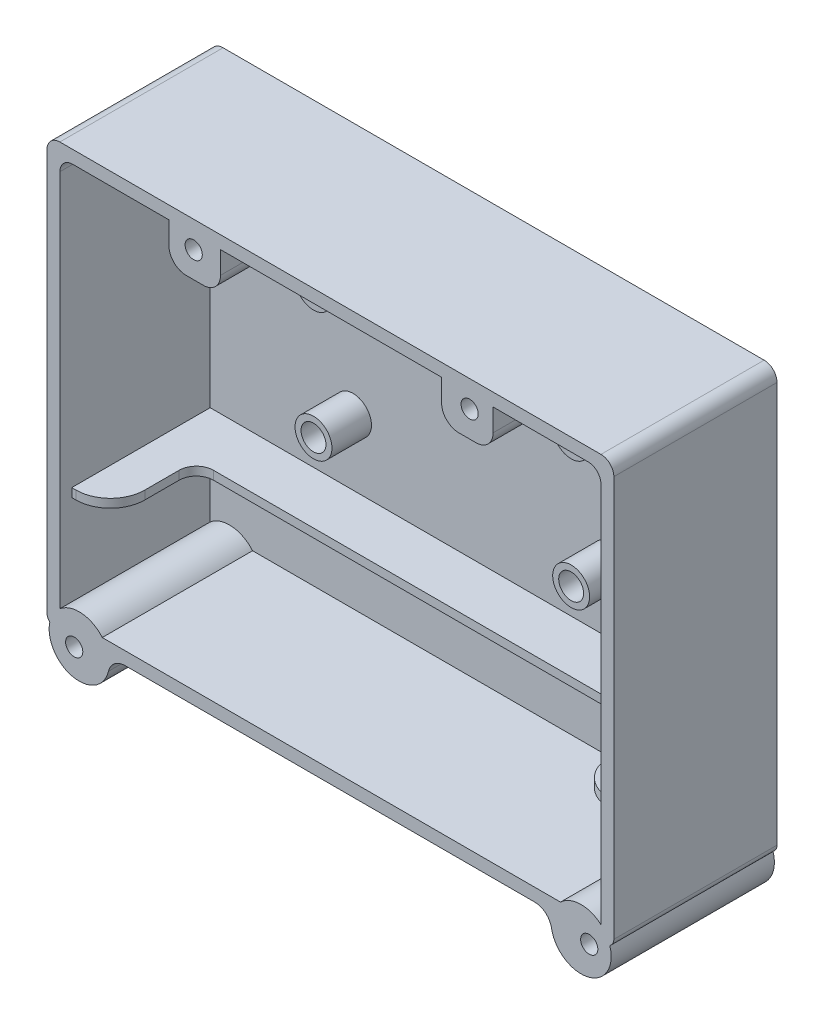
from build123d import *

# Parameters (mm, degrees)
SKETCH1_W           = 66
SKETCH1_H           = 49
BOSS_EXTRUDE1_DEPTH = 19
SHELL1_T            = -1.5
SKETCH2_W           = 6
SKETCH2_H           = 4.6
BOSS_EXTRUDE2_DEPTH = 17.5
FILLET1_R           = 1.5
SKETCH3_R           = 2.15
SKETCH3_R_2         = 1.45
BOSS_EXTRUDE3_DEPTH = 4.6
BOSS_EXTRUDE4_DEPTH = 0.5
FILLET2_R           = 4
FILLET3_R           = 2
BOSS_EXTRUDE5_REACH = 351.368
SKETCH5_R           = 3.5
FILLET4_R           = 2
SKETCH6_R           = 1
CUT_EXTRUDE1_DEPTH  = 350.367542449
FILLET5_R           = 1


with BuildPart() as part:
    # Sketch1 → Boss-Extrude1 (new body)
    with BuildSketch(Plane.XY.offset(30)):
        with Locations((105.809562907, 295.544660887)):
            Rectangle(SKETCH1_W, SKETCH1_H)
    extrude(amount=BOSS_EXTRUDE1_DEPTH)

    # Shell1
    shell1_openings = [part.faces().sort_by_distance(p)[0] for p in [
        (105.809562907, 295.544660887, 49),
    ]]
    offset(amount=SHELL1_T, openings=shell1_openings, kind=Kind.INTERSECTION)

    # Sketch2 → Boss-Extrude2 (add)
    with BuildSketch(Plane.XY.offset(31.5)):
        with Locations((90.011318394, 316.244660887)):
            Rectangle(SKETCH2_W, SKETCH2_H)
        with Locations((121.756668801, 316.244660887)):
            Rectangle(SKETCH2_W, SKETCH2_H)
    extrude(amount=BOSS_EXTRUDE2_DEPTH)

    # Fillet1
    fillet1_edges = [part.edges().sort_by_distance(p)[0] for p in [
        (74.309562907, 318.544660887, 40.25),
        (137.309562907, 318.544660887, 40.25),
        (72.809562907, 320.044660887, 39.5),
        (138.809562907, 320.044660887, 39.5),
    ]]
    fillet(fillet1_edges, radius=FILLET1_R)

    # Sketch3 → Boss-Extrude3 (add)
    # profile 1 of 4: a face of its own
    with BuildSketch(Plane.XY.offset(31.5)):
        with Locations((90.939840403, 307.111410879)):
            Circle(SKETCH3_R)
        with Locations((90.939840403, 307.111410879)):
            Circle(SKETCH3_R_2, mode=Mode.SUBTRACT)
    # profile 2 of 4: a face of its own
    with BuildSketch(Plane.XY.offset(31.5)):
        with Locations((120.939840403, 307.111410879)):
            Circle(SKETCH3_R)
        with Locations((120.939840403, 307.111410879)):
            Circle(SKETCH3_R_2, mode=Mode.SUBTRACT)
    # profile 3 of 4: a face of its own
    with BuildSketch(Plane.XY.offset(31.5)):
        with Locations((120.939840403, 292.111410879)):
            Circle(SKETCH3_R)
        with Locations((120.939840403, 292.111410879)):
            Circle(SKETCH3_R_2, mode=Mode.SUBTRACT)
    # profile 4 of 4: a face of its own
    with BuildSketch(Plane.XY.offset(31.5)):
        with Locations((90.939840403, 292.111410879)):
            Circle(SKETCH3_R)
        with Locations((90.939840403, 292.111410879)):
            Circle(SKETCH3_R_2, mode=Mode.SUBTRACT)
    extrude(amount=BOSS_EXTRUDE3_DEPTH)

    # Sketch4 → Boss-Extrude4 (add, symmetric)
    with BuildSketch(Plane(origin=(0, 284, 0), x_dir=(1, 0, 0), z_dir=(0, 1, 0))):
        Polygon((72.809562907, -47.615589413), (78.809562907, -47.615589413), (78.809562907, -37.615589413), (132.809562907, -37.615589413), (132.809562907, -47.615589413), (138.809562907, -47.615589413), (138.809562907, -30), (72.809562907, -30), align=None)
    extrude(amount=BOSS_EXTRUDE4_DEPTH, both=True)

    # Fillet2
    fillet2_edges = [part.edges().sort_by_distance(p)[0] for p in [
        (78.809562907, 284, 47.615589413),
        (132.809562907, 284, 47.615589413),
    ]]
    fillet(fillet2_edges, radius=FILLET2_R)

    # Fillet3
    fillet3_edges = [part.edges().sort_by_distance(p)[0] for p in [
        (78.809562907, 284, 37.615589413),
        (132.809562907, 284, 37.615589413),
    ]]
    fillet(fillet3_edges, radius=FILLET3_R)

    # Boss-Extrude5: up to this face of the body (flat: up to its plane)
    boss_extrude5_end = Plane(part.part.faces().sort_by_distance((105.809562907, 295.537442811, 30))[0])
    # Sketch5 → Boss-Extrude5 (add, up to the picked face)
    with BuildSketch(Plane.XY.offset(49), mode=Mode.PRIVATE) as boss_extrude5_sk1:
        with Locations((76.56102911, 270.299359986)):
            Circle(SKETCH5_R)
    boss_extrude5_tool1 = split(extrude(boss_extrude5_sk1.sketch, amount=-BOSS_EXTRUDE5_REACH, mode=Mode.PRIVATE), bisect_by=boss_extrude5_end, keep=Keep.BOTH, mode=Mode.PRIVATE)
    # Sketch5 → Boss-Extrude5 (add, up to the picked face)
    with BuildSketch(Plane.XY.offset(49), mode=Mode.PRIVATE) as boss_extrude5_sk2:
        with Locations((135, 270)):
            Circle(SKETCH5_R)
    boss_extrude5_tool2 = split(extrude(boss_extrude5_sk2.sketch, amount=-BOSS_EXTRUDE5_REACH, mode=Mode.PRIVATE), bisect_by=boss_extrude5_end, keep=Keep.BOTH, mode=Mode.PRIVATE)
    add(boss_extrude5_tool1.solids().sort_by(Axis((76.561029, 270.29936, 49), (0, 0, -1)))[0])
    add(boss_extrude5_tool2.solids().sort_by(Axis((135, 270, 49), (0, 0, -1)))[0])

    # Fillet4
    fillet4_edges = [part.edges().sort_by_distance(p)[0] for p in [
        (79.980755206, 271.044660887, 39.5),
        (131.659538411, 271.044660887, 39.5),
        (87.011318394, 313.944660887, 40.25),
        (93.011318394, 313.944660887, 40.25),
        (118.756668801, 313.944660887, 40.25),
        (124.756668801, 313.944660887, 40.25),
    ]]
    fillet(fillet4_edges, radius=FILLET4_R)

    # Sketch6 → Cut-Extrude1 (cut, through all)
    with BuildSketch(Plane.XY.offset(49)):
        with Locations((89.892121314, 316.968054702)):
            Circle(SKETCH6_R)
        with Locations((122.022521406, 316.968054702)):
            Circle(SKETCH6_R)
        with Locations((75.978849521, 269.963322555)):
            Circle(SKETCH6_R)
        with Locations((135.943985107, 269.963322555)):
            Circle(SKETCH6_R)
    extrude(amount=-CUT_EXTRUDE1_DEPTH, mode=Mode.SUBTRACT)

    # Fillet5
    # the kernel refuses this fillet: 1 mm, written as the material it takes off along each edge
    with BuildSketch(Plane(origin=(72.809562907, 271.044660887, 28.140180255), x_dir=(1, 0, 0), z_dir=(0, 0, 1))) as fillet5_piece_1:
        with BuildLine():
            CenterArc((1, 0.743927898), FILLET5_R, 180, 48.067095939)
            Line((0, 0.743927898), (-0.02, 0.743927898))
            Line((-0.02, 0.743927898), (-0.02, 0))
            Line((-0.02, 0), (0, -0.02))
            ThreePointArc((0, -0.02), (0.165870054, -0.02), (0.31837491, -0.014878558))
            Line((0.31837491, -0.014878558), (0.331740108, 0))
        make_face()
    extrude(amount=22.719639489, mode=Mode.SUBTRACT)
    with BuildSketch(Plane(origin=(138.809562907, 271.044660887, 27.881411748), x_dir=(-1, 0, 0), z_dir=(0, 0, 1))) as fillet5_piece_2:
        with BuildLine():
            CenterArc((1, -0.847435301), FILLET5_R, 122.066195324, 57.933804676)
            Line((0, -0.847435301), (-0.02, -0.847435301))
            Line((-0.02, -0.847435301), (-0.02, 0))
            Line((-0.02, 0), (0, 0.02))
            ThreePointArc((0, 0.02), (0.234550659, 0.02), (0.458483344, 0.016948706))
            Line((0.458483344, 0.016948706), (0.469101317, 0))
        make_face()
    extrude(amount=23.237176503, mode=Mode.SUBTRACT)


solid = part.part
